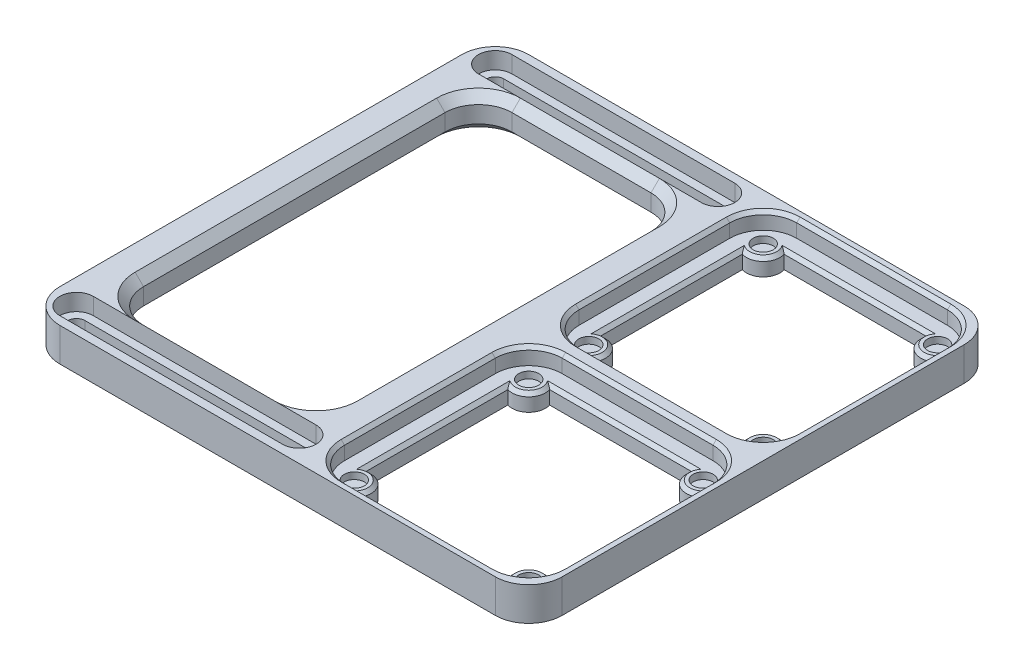
from build123d import *

# Parameters (mm, degrees)
SKETCH1_W           = 70
SKETCH1_H           = 70
BOSS_EXTRUDE2_DEPTH = 7
CUT_EXTRUDE1_DEPTH  = 5
SKETCH9_W           = 70
SKETCH9_H           = 70
BOSS_EXTRUDE3_DEPTH = 5
CUT_EXTRUDE11_DEPTH = 100.242128151
SKETCH21_R          = 3
CUT_EXTRUDE12_DEPTH = 2
CHAMFER3_SIZE       = 1
CUT_EXTRUDE13_START = -2
SKETCH22_W          = 70
SKETCH22_H          = 70
CUT_EXTRUDE13_DEPTH = 2
FILLET1_R           = 10
SKETCH23_W          = 140
SKETCH23_H          = 10
BOSS_EXTRUDE4_DEPTH = 80
CUT_EXTRUDE14_DEPTH = 70
FILLET2_R           = 10
CUT_EXTRUDE15_DEPTH = 70
CHAMFER5_SIZE       = 2.5
CUT_EXTRUDE16_DEPTH = 5
CUT_EXTRUDE17_DEPTH = 5


with BuildPart() as part:
    # Sketch1 → Boss-Extrude2 (new body)
    with BuildSketch(Plane(origin=(0, 0, 0), x_dir=(1, 0, 0), z_dir=(0, 1, 0))):
        with Locations((35, 35)):
            Rectangle(SKETCH1_W, SKETCH1_H)
    extrude(amount=BOSS_EXTRUDE2_DEPTH)

    # Sketch3 → Cut-Extrude1 (cut)
    with BuildSketch(Plane(origin=(0, 7, 0), x_dir=(1, 0, 0), z_dir=(0, 1, 0))):
        with BuildLine():
            Line((2.5, 57.5), (2.5, 12.5))
            ThreePointArc((2.5, 12.5), (5.428932188, 5.428932188), (12.5, 2.5))
            Line((12.5, 2.5), (57.5, 2.5))
            ThreePointArc((57.5, 2.5), (64.571067812, 5.428932188), (67.5, 12.5))
            Line((67.5, 12.5), (67.5, 57.5))
            ThreePointArc((67.5, 57.5), (64.571067812, 64.571067812), (57.5, 67.5))
            Line((57.5, 67.5), (12.5, 67.5))
            ThreePointArc((12.5, 67.5), (5.428932188, 64.571067812), (2.5, 57.5))
        make_face()
    extrude(amount=-CUT_EXTRUDE1_DEPTH, mode=Mode.SUBTRACT)

    # Sketch9 → Boss-Extrude3 (add)
    with BuildSketch(Plane.XZ):
        with Locations((35, -35)):
            Rectangle(SKETCH9_W, SKETCH9_H)
    extrude(amount=BOSS_EXTRUDE3_DEPTH)

    # Sketch20 → Cut-Extrude11 (cut, through all)
    with BuildSketch(Plane(origin=(0, 2, 0), x_dir=(1, 0, 0), z_dir=(0, 1, 0))):
        with BuildLine():
            Line((13.745191882, 7.5), (56.254808118, 7.5))
            ThreePointArc((56.254808118, 7.5), (57.5, 12.5), (62.5, 13.745191882))
            Line((62.5, 13.745191882), (62.5, 56.254808118))
            ThreePointArc((62.5, 56.254808118), (57.5, 57.5), (56.254808118, 62.5))
            Line((56.254808118, 62.5), (13.745191882, 62.5))
            ThreePointArc((13.745191882, 62.5), (12.5, 57.5), (7.5, 56.254808118))
            Line((7.5, 56.254808118), (7.5, 13.745191882))
            ThreePointArc((7.5, 13.745191882), (12.5, 12.5), (13.745191882, 7.5))
        make_face()
    extrude(amount=-CUT_EXTRUDE11_DEPTH, mode=Mode.SUBTRACT)

    # Sketch21 → Cut-Extrude12 (cut)
    with BuildSketch(Plane(origin=(0, 2, 0), x_dir=(1, 0, 0), z_dir=(0, 1, 0))):
        with Locations(Location((8.964466094, 61.035533906, 0), (0, 0, 270))):
            Circle(SKETCH21_R)
        with Locations(Location((61.035533906, 61.035533906, 0), (0, 0, 270))):
            Circle(SKETCH21_R)
        with Locations(Location((61.035533906, 8.964466094, 0), (0, 0, 270))):
            Circle(SKETCH21_R)
        with Locations(Location((8.964466094, 8.964466094, 0), (0, 0, 270))):
            Circle(SKETCH21_R)
    extrude(amount=-CUT_EXTRUDE12_DEPTH, mode=Mode.SUBTRACT)

    # Chamfer3
    chamfer3_edges = [part.edges().sort_by_distance(p)[0] for p in [
        (5.428932188, 7, -5.428932188),
        (35, 7, -2.5),
        (64.571067812, 7, -5.428932188),
        (67.5, 7, -35),
        (64.571067812, 7, -64.571067812),
        (35, 7, -67.5),
        (5.428932188, 7, -64.571067812),
        (2.5, 7, -35),
        (12.5, 2, -12.5),
        (12.5, 2, -57.5),
        (57.5, 2, -57.5),
        (57.5, 2, -12.5),
        (35, 2, -7.5),
        (62.5, 2, -35),
        (35, 2, -62.5),
        (7.5, 2, -35),
    ]]
    chamfer(chamfer3_edges, length=CHAMFER3_SIZE)

    # Sketch22 → Cut-Extrude13 (cut)
    with BuildSketch(Plane.XZ.offset(5).offset(CUT_EXTRUDE13_START)):
        with Locations((35, -35)):
            Rectangle(SKETCH22_W, SKETCH22_H)
        with BuildLine():
            Line((7.5, -13.745191882), (7.5, -56.254808118))
            ThreePointArc((7.5, -56.254808118), (12.5, -57.5), (13.745191882, -62.5))
            Line((13.745191882, -62.5), (56.254808118, -62.5))
            ThreePointArc((56.254808118, -62.5), (57.5, -57.5), (62.5, -56.254808118))
            Line((62.5, -56.254808118), (62.5, -13.745191882))
            ThreePointArc((62.5, -13.745191882), (57.5, -12.5), (56.254808118, -7.5))
            Line((56.254808118, -7.5), (13.745191882, -7.5))
            ThreePointArc((13.745191882, -7.5), (12.5, -12.5), (7.5, -13.745191882))
        make_face(mode=Mode.SUBTRACT)
    extrude(amount=CUT_EXTRUDE13_DEPTH, mode=Mode.SUBTRACT)

    # Mirror2: part across plane


with BuildPart() as part_1:
    add(part.part)
    add(part.part.mirror(Plane(origin=(0, 7, -70), x_dir=(1, 0, 0), z_dir=(0, 0, 1))))

    # Fillet1
    fillet1_edges = [part_1.edges().sort_by_distance(p)[0] for p in [
        (70, 2, -140),
        (70, 2, 0),
    ]]
    fillet(fillet1_edges, radius=FILLET1_R)

    # Sketch23 → Boss-Extrude4 (add)
    with BuildSketch(Plane.ZY):
        with Locations((-70, 2)):
            Rectangle(SKETCH23_W, SKETCH23_H)
    extrude(amount=BOSS_EXTRUDE4_DEPTH)

    # Sketch24 → Cut-Extrude14 (cut)
    with BuildSketch(Plane(origin=(0, 7, 0), x_dir=(1, 0, 0), z_dir=(0, 1, 0))):
        with BuildLine():
            Line((-72.5, 5), (-6, 5))
            ThreePointArc((-6, 5), (-3.5, 7.5), (-6, 10))
            Line((-6, 10), (-72.5, 10))
            ThreePointArc((-72.5, 10), (-75, 7.5), (-72.5, 5))
        make_face()
        with BuildLine():
            Line((-72.5, 135), (-6, 135))
            ThreePointArc((-6, 135), (-3.5, 132.5), (-6, 130))
            Line((-6, 130), (-72.5, 130))
            ThreePointArc((-72.5, 130), (-75, 132.5), (-72.5, 135))
        make_face()
    extrude(amount=-CUT_EXTRUDE14_DEPTH, mode=Mode.SUBTRACT)

    # Fillet2
    fillet2_edges = [part_1.edges().sort_by_distance(p)[0] for p in [
        (-80, 2, -140),
        (-80, 2, 0),
    ]]
    fillet(fillet2_edges, radius=FILLET2_R)

    # Sketch25 → Cut-Extrude15 (cut)
    with BuildSketch(Plane(origin=(0, 7, 0), x_dir=(1, 0, 0), z_dir=(0, 1, 0))):
        with BuildLine():
            Line((-70, 25), (-70, 115))
            ThreePointArc((-70, 115), (-67.071067812, 122.071067812), (-60, 125))
            Line((-60, 125), (-18.5, 125))
            ThreePointArc((-18.5, 125), (-11.428932188, 122.071067812), (-8.5, 115))
            Line((-8.5, 115), (-8.5, 25))
            ThreePointArc((-8.5, 25), (-11.428932188, 17.928932188), (-18.5, 15))
            Line((-18.5, 15), (-60, 15))
            ThreePointArc((-60, 15), (-67.071067812, 17.928932188), (-70, 25))
        make_face()
    extrude(amount=-CUT_EXTRUDE15_DEPTH, mode=Mode.SUBTRACT)

    # Chamfer5
    chamfer5_edges = [part_1.edges().sort_by_distance(p)[0] for p in [
        (-3.5, 7, -7.5),
        (-75, 7, -7.5),
        (-39.25, 7, -10),
        (-39.25, 7, -5),
        (-39.25, 7, -135),
        (-39.25, 7, -130),
        (-3.5, 7, -132.5),
        (-75, 7, -132.5),
        (-67.071067812, -3, -17.928932188),
        (-39.25, -3, -15),
        (-11.428932188, -3, -17.928932188),
        (-8.5, -3, -70),
        (-11.428932188, -3, -122.071067812),
        (-39.25, -3, -125),
        (-67.071067812, -3, -122.071067812),
        (-70, -3, -70),
        (-70, 7, -70),
        (-67.071067812, 7, -122.071067812),
        (-39.25, 7, -125),
        (-11.428932188, 7, -122.071067812),
        (-8.5, 7, -70),
        (-11.428932188, 7, -17.928932188),
        (-39.25, 7, -15),
        (-67.071067812, 7, -17.928932188),
    ]]
    chamfer(chamfer5_edges, length=CHAMFER5_SIZE - 0.0001)  # a hair under: the kernel refuses the full size

    # Sketch26 → Cut-Extrude16 (cut)
    with BuildSketch(Plane(origin=(0, 7, 0), x_dir=(1, 0, 0), z_dir=(0, 1, 0))):
        with BuildLine():
            ThreePointArc((-72.5, 137.5), (-77.5, 132.5), (-72.5, 127.5))
            ThreePointArc((-72.5, 127.5), (-68.964466094, 128.964466094), (-67.5, 132.5))
            ThreePointArc((-67.5, 132.5), (-68.964466094, 136.035533906), (-72.5, 137.5))
        make_face()
        with BuildLine():
            ThreePointArc((-67.5, 132.5), (-68.964466094, 128.964466094), (-72.5, 127.5))
            Line((-72.5, 127.5), (-60, 127.5))
            Line((-60, 127.5), (-18.5, 127.5))
            Line((-18.5, 127.5), (-6, 127.5))
            ThreePointArc((-6, 127.5), (-11, 132.5), (-6, 137.5))
            Line((-6, 137.5), (-72.5, 137.5))
            ThreePointArc((-72.5, 137.5), (-68.964466094, 136.035533906), (-67.5, 132.5))
        make_face()
        with BuildLine():
            Line((-6, 127.5), (-6, 137.5))
            ThreePointArc((-6, 137.5), (-1, 132.5), (-6, 127.5))
        make_face()
        with BuildLine():
            ThreePointArc((-1, 132.5), (-2.464466094, 136.035533906), (-6, 137.5))
            Line((-6, 137.5), (-6, 127.5))
            ThreePointArc((-6, 127.5), (-2.464466094, 128.964466094), (-1, 132.5))
        make_face()
        with BuildLine():
            Line((-6, 127.5), (-6, 137.5))
            ThreePointArc((-6, 137.5), (-11, 132.5), (-6, 127.5))
        make_face()
    extrude(amount=-CUT_EXTRUDE16_DEPTH, mode=Mode.SUBTRACT)

    # Sketch27 → Cut-Extrude17 (cut)
    with BuildSketch(Plane(origin=(0, 7, 0), x_dir=(1, 0, 0), z_dir=(0, 1, 0))):
        with BuildLine():
            ThreePointArc((-6, 12.5), (-11, 7.5), (-6, 2.5))
            Line((-6, 2.5), (-6, 12.5))
        make_face()
        with BuildLine():
            Line((-6, 12.5), (-6, 2.5))
            ThreePointArc((-6, 2.5), (-2.464466094, 3.964466094), (-1, 7.5))
            ThreePointArc((-1, 7.5), (-2.464466094, 11.035533906), (-6, 12.5))
        make_face()
        with BuildLine():
            Line((-6, 12.5), (-6, 2.5))
            ThreePointArc((-6, 2.5), (-1, 7.5), (-6, 12.5))
        make_face()
        with BuildLine():
            Line((-60, 12.5), (-72.5, 12.5))
            ThreePointArc((-72.5, 12.5), (-68.964466094, 11.035533906), (-67.5, 7.5))
            ThreePointArc((-67.5, 7.5), (-68.964466094, 3.964466094), (-72.5, 2.5))
            Line((-72.5, 2.5), (-6, 2.5))
            ThreePointArc((-6, 2.5), (-11, 7.5), (-6, 12.5))
            Line((-6, 12.5), (-18.5, 12.5))
            Line((-18.5, 12.5), (-60, 12.5))
        make_face()
        with BuildLine():
            ThreePointArc((-67.5, 7.5), (-68.964466094, 11.035533906), (-72.5, 12.5))
            ThreePointArc((-72.5, 12.5), (-77.5, 7.5), (-72.5, 2.5))
            ThreePointArc((-72.5, 2.5), (-68.964466094, 3.964466094), (-67.5, 7.5))
        make_face()
    extrude(amount=-CUT_EXTRUDE17_DEPTH, mode=Mode.SUBTRACT)


solid = part_1.part
